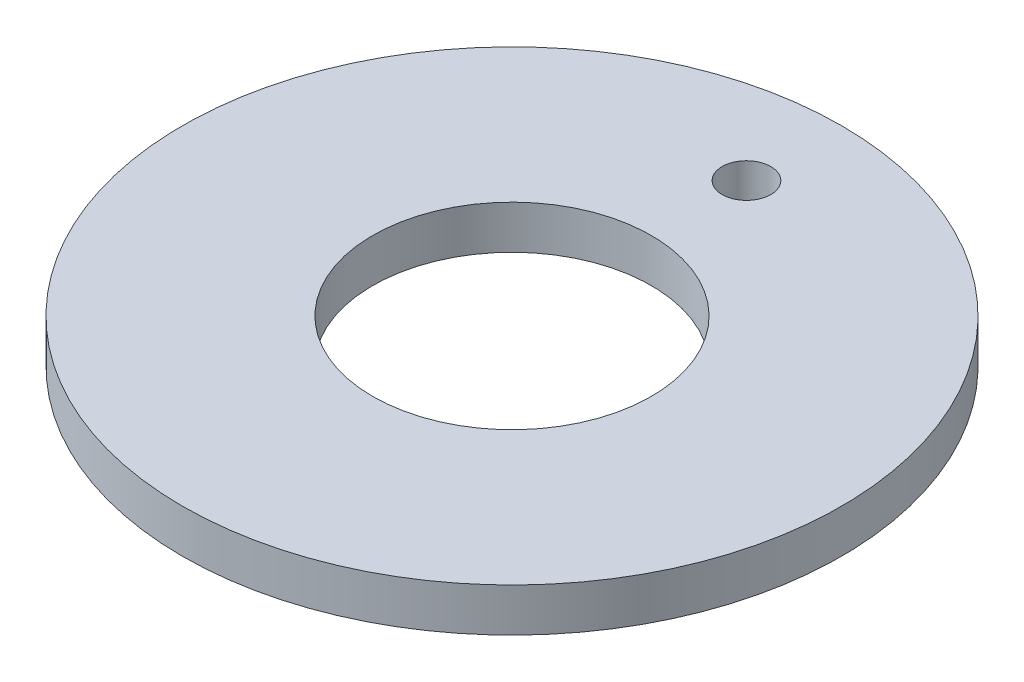
from build123d import *

# Parameters (mm, degrees)
SKETCH1_R           = 37.95
SKETCH1_R_2         = 16.05
SKETCH1_R_3         = 2.8
BOSS_EXTRUDE1_DEPTH = 5


with BuildPart() as part:
    # Sketch1 → Boss-Extrude1 (new body)
    with BuildSketch(Plane(origin=(0, 0, 0), x_dir=(1, 0, 0), z_dir=(0, 1, 0))):
        Circle(SKETCH1_R)
        Circle(SKETCH1_R_2, mode=Mode.SUBTRACT)
        with Locations((0, 27)):
            Circle(SKETCH1_R_3, mode=Mode.SUBTRACT)
    extrude(amount=BOSS_EXTRUDE1_DEPTH)


solid = part.part
